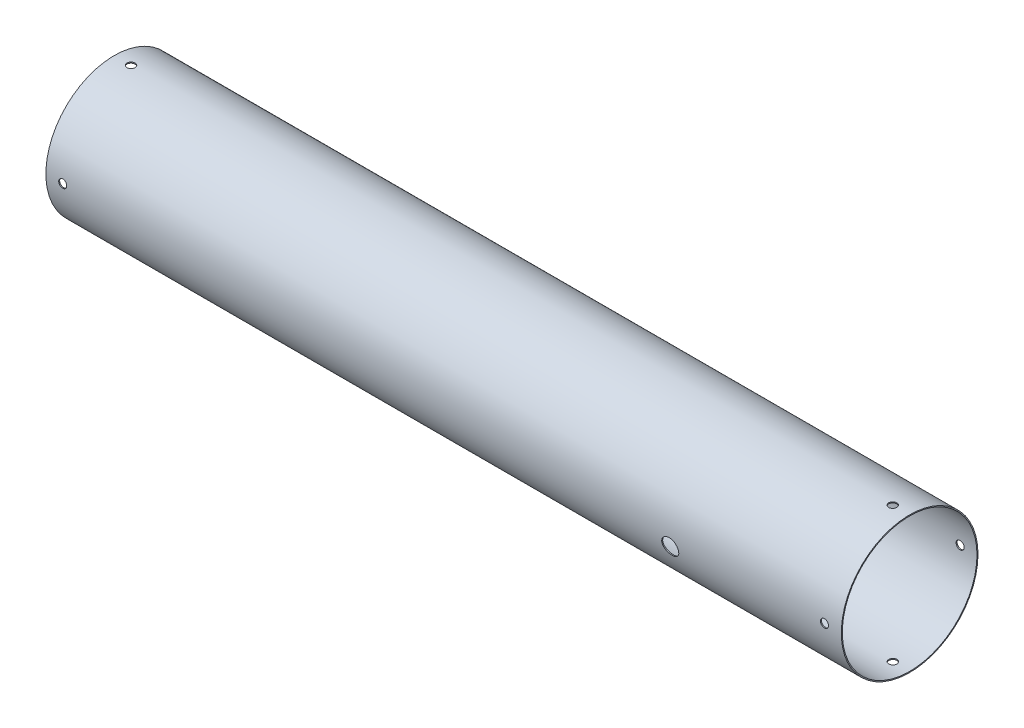
from build123d import *

# Parameters (mm, degrees)
SKETCH1_R               = 51.562
SKETCH1_R_2             = 50.8
BOSS_EXTRUDE1_DEPTH     = 300
CUT_EXTRUDE1_DEPTH      = 309.73496674
CUT_EXTRUDE1_DEPTH_BACK = 309.73496674
SKETCH3_R               = 6.35
SKETCH4_R               = 3.048
CUT_EXTRUDE2_DEPTH      = 309.734966871
CIRPATTERN1_COUNT       = 2
CIRPATTERN1_ANGLE       = 90


with BuildPart() as part:
    # Sketch1 → Boss-Extrude1 (new, symmetric)
    with BuildSketch(Plane(origin=(0, 0, 0), x_dir=(0, 0, -1), z_dir=(1, 0, 0))):
        Circle(SKETCH1_R)
        Circle(SKETCH1_R_2, mode=Mode.SUBTRACT)
    extrude(amount=BOSS_EXTRUDE1_DEPTH, both=True)

    # Sketch3 → Cut-Extrude1 (cut, two sides: drawn at the far end of the back side and taken through both)
    with BuildSketch(Plane.XY.offset(-CUT_EXTRUDE1_DEPTH_BACK)):
        with Locations((170.180000052, -8.89)):
            Circle(SKETCH3_R)
    extrude(amount=CUT_EXTRUDE1_DEPTH + CUT_EXTRUDE1_DEPTH_BACK, mode=Mode.SUBTRACT)

    # Sketch4 → Cut-Extrude2 (cut, symmetric)
    with BuildSketch(Plane.XY):
        with Locations((287.3, 0)):
            Circle(SKETCH4_R)
        with Locations((-287.3, 0)):
            Circle(SKETCH4_R)
    cut_extrude2 = extrude(amount=CUT_EXTRUDE2_DEPTH, both=True, mode=Mode.SUBTRACT)

    # CirPattern1: Cut-Extrude2 ×2 about axis
    cirpattern1_axis = Axis((300, 0, 0), (-1, 0, 0))
    for i in range(1, CIRPATTERN1_COUNT):
        add(cut_extrude2.rotate(cirpattern1_axis, i * CIRPATTERN1_ANGLE / (CIRPATTERN1_COUNT - 1)), mode=Mode.SUBTRACT)


solid = part.part
